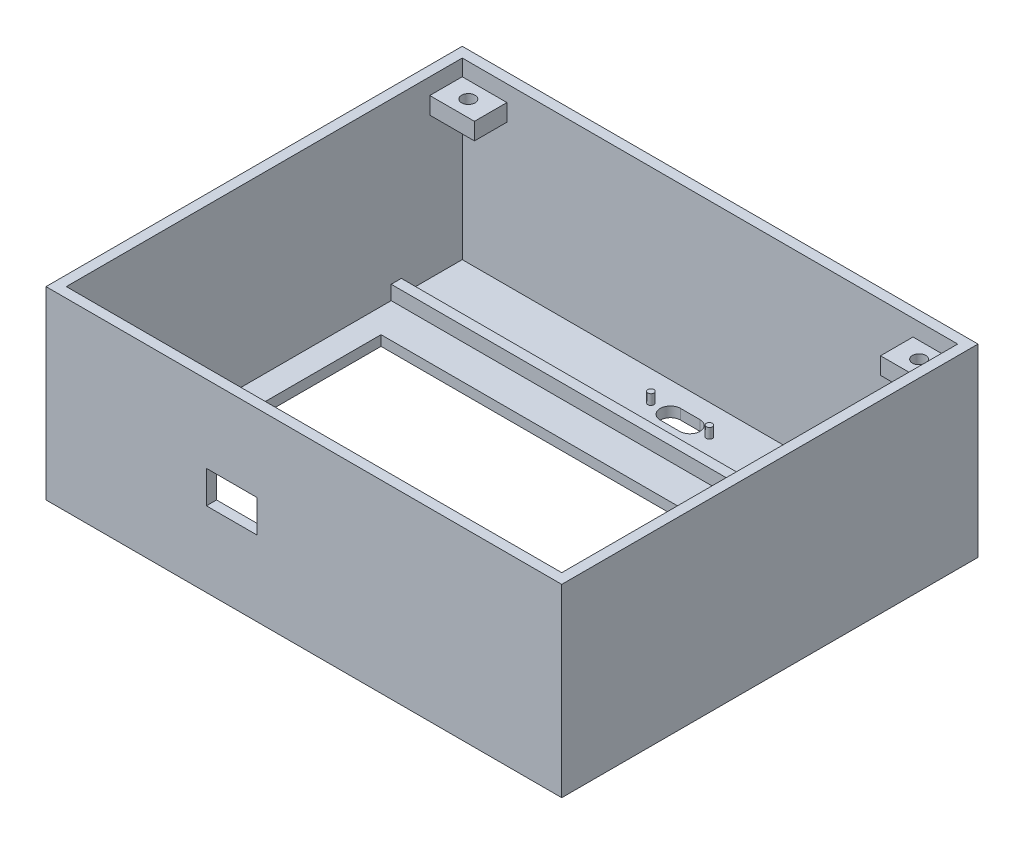
from build123d import *

# Parameters (mm, degrees)
SKETCH1_W           = 127
SKETCH1_H           = 85
BOSS_EXTRUDE1_DEPTH = 2.5
SKETCH2_W           = 127
SKETCH2_H           = 85
SKETCH2_W_2         = 122
SKETCH2_H_2         = 80
BOSS_EXTRUDE2_DEPTH = 38.5
SKETCH3_W           = 110
SKETCH3_H           = 68.5
CUT_EXTRUDE1_DEPTH  = 2.5
BOSS_EXTRUDE3_DEPTH = 15
SKETCH10_W          = 122
SKETCH10_H          = 2.5
CUT_EXTRUDE2_DEPTH  = 35
SKETCH11_W          = 127
SKETCH11_H          = 41
BOSS_EXTRUDE4_DEPTH = 2.5
CUT_EXTRUDE4_DEPTH  = 2.5
SKETCH14_W          = 15
SKETCH14_H          = 1
CUT_EXTRUDE5_DEPTH  = 1.5
SKETCH13_R          = 0.75
BOSS_EXTRUDE6_DEPTH = 2.5
SKETCH17_W          = 12.5
SKETCH17_H          = 8
CUT_EXTRUDE6_DEPTH  = 2.5
SKETCH19_W          = 127
SKETCH19_H          = 102.5
SKETCH19_W_2        = 122
SKETCH19_H_2        = 97.5
BOSS_EXTRUDE7_DEPTH = 4.5
SKETCH20_W          = 11
SKETCH20_H          = 4.184181858
BOSS_EXTRUDE8_DEPTH = 8
SKETCH22_R          = 1.65
CUT_EXTRUDE7_DEPTH  = 5


with BuildPart() as part:
    # Sketch1 → Boss-Extrude1 (new body)
    with BuildSketch(Plane(origin=(0, 0, 0), x_dir=(1, 0, 0), z_dir=(0, 1, 0))):
        with Locations((63.5, 42.5)):
            Rectangle(SKETCH1_W, SKETCH1_H)
    extrude(amount=BOSS_EXTRUDE1_DEPTH)

    # Sketch2 → Boss-Extrude2 (add)
    with BuildSketch(Plane(origin=(0, 2.5, 0), x_dir=(1, 0, 0), z_dir=(0, 1, 0))):
        with Locations((63.5, 42.5)):
            Rectangle(SKETCH2_W, SKETCH2_H)
        with Locations((63.5, 42.5)):
            Rectangle(SKETCH2_W_2, SKETCH2_H_2, mode=Mode.SUBTRACT)
    extrude(amount=BOSS_EXTRUDE2_DEPTH)

    # Sketch3 → Cut-Extrude1 (cut)
    with BuildSketch(Plane(origin=(0, 0, 0), x_dir=(-1, 0, 0), z_dir=(0, -1, 0))):
        with Locations((-63.5, 39.75)):
            Rectangle(SKETCH3_W, SKETCH3_H)
    extrude(amount=-CUT_EXTRUDE1_DEPTH, mode=Mode.SUBTRACT)

    # Sketch9 → Boss-Extrude3 (add)
    with BuildSketch(Plane(origin=(0, 0, -85), x_dir=(-1, 0, 0), z_dir=(0, 0, -1))):
        Polygon((-127, 0), (0, 0), (0, 2.5), (0, 41), (-2.5, 41), (-2.5, 2.5), (-124.5, 2.5), (-124.5, 41), (-127, 41), (-127, 2.5), align=None)
    extrude(amount=BOSS_EXTRUDE3_DEPTH)

    # Sketch10 → Cut-Extrude2 (cut)
    with BuildSketch(Plane(origin=(0, 41, 0), x_dir=(1, 0, 0), z_dir=(0, 1, 0))):
        with Locations((63.5, 83.75)):
            Rectangle(SKETCH10_W, SKETCH10_H)
    extrude(amount=-CUT_EXTRUDE2_DEPTH, mode=Mode.SUBTRACT)

    # Sketch11 → Boss-Extrude4 (add)
    with BuildSketch(Plane(origin=(0, 0, -100), x_dir=(-1, 0, 0), z_dir=(0, 0, -1))):
        with Locations((-63.5, 20.5)):
            Rectangle(SKETCH11_W, SKETCH11_H)
    extrude(amount=BOSS_EXTRUDE4_DEPTH)

    # Sketch6 → Cut-Extrude4 (cut)
    with BuildSketch(Plane(origin=(0, 0, 0), x_dir=(-1, 0, 0), z_dir=(0, -1, 0))):
        with BuildLine():
            Line((-61.1, 90.153713072), (-65.9, 90.153713072))
            ThreePointArc((-65.9, 90.153713072), (-68.4, 92.653713072), (-65.9, 95.153713072))
            Line((-65.9, 95.153713072), (-61.1, 95.153713072))
            ThreePointArc((-61.1, 95.153713072), (-58.6, 92.653713072), (-61.1, 90.153713072))
        make_face()
    extrude(amount=-CUT_EXTRUDE4_DEPTH, mode=Mode.SUBTRACT)

    # Sketch14 → Cut-Extrude5 (cut)
    with BuildSketch(Plane(origin=(0, 2.5, 0), x_dir=(1, 0, 0), z_dir=(0, 1, 0))):
        with Locations((63.5, 86.653713072)):
            Rectangle(SKETCH14_W, SKETCH14_H)
    extrude(amount=-CUT_EXTRUDE5_DEPTH, mode=Mode.SUBTRACT)

    # Sketch13 → Boss-Extrude6 (add)
    with BuildSketch(Plane(origin=(0, 2.5, 0), x_dir=(1, 0, 0), z_dir=(0, 1, 0))):
        with Locations((56.3, 92.653713072)):
            Circle(SKETCH13_R)
        with Locations((70.7, 92.653713072)):
            Circle(SKETCH13_R)
    extrude(amount=BOSS_EXTRUDE6_DEPTH)

    # Sketch17 → Cut-Extrude6 (cut)
    with BuildSketch(Plane.XY):
        with Locations((45.75, 22.5)):
            Rectangle(SKETCH17_W, SKETCH17_H)
    extrude(amount=-CUT_EXTRUDE6_DEPTH, mode=Mode.SUBTRACT)

    # Sketch19 → Boss-Extrude7 (add)
    with BuildSketch(Plane(origin=(0, 41, 0), x_dir=(1, 0, 0), z_dir=(0, 1, 0))):
        with Locations((63.5, 51.25)):
            Rectangle(SKETCH19_W, SKETCH19_H)
        with Locations((63.5, 51.25)):
            Rectangle(SKETCH19_W_2, SKETCH19_H_2, mode=Mode.SUBTRACT)
    extrude(amount=BOSS_EXTRUDE7_DEPTH)

    # Sketch20 → Boss-Extrude8 (add)
    with BuildSketch(Plane.XY.offset(-100)):
        with Locations((8, 39.407909071)):
            Rectangle(SKETCH20_W, SKETCH20_H)
        with Locations((119, 39.407909071)):
            Rectangle(SKETCH20_W, SKETCH20_H)
    extrude(amount=BOSS_EXTRUDE8_DEPTH)

    # Sketch22 → Cut-Extrude7 (cut)
    with BuildSketch(Plane(origin=(0, 41.5, 0), x_dir=(1, 0, 0), z_dir=(0, 1, 0))):
        with Locations((8, 96)):
            Circle(SKETCH22_R)
        with Locations((119, 96)):
            Circle(SKETCH22_R)
    extrude(amount=-CUT_EXTRUDE7_DEPTH, mode=Mode.SUBTRACT)


solid = part.part
